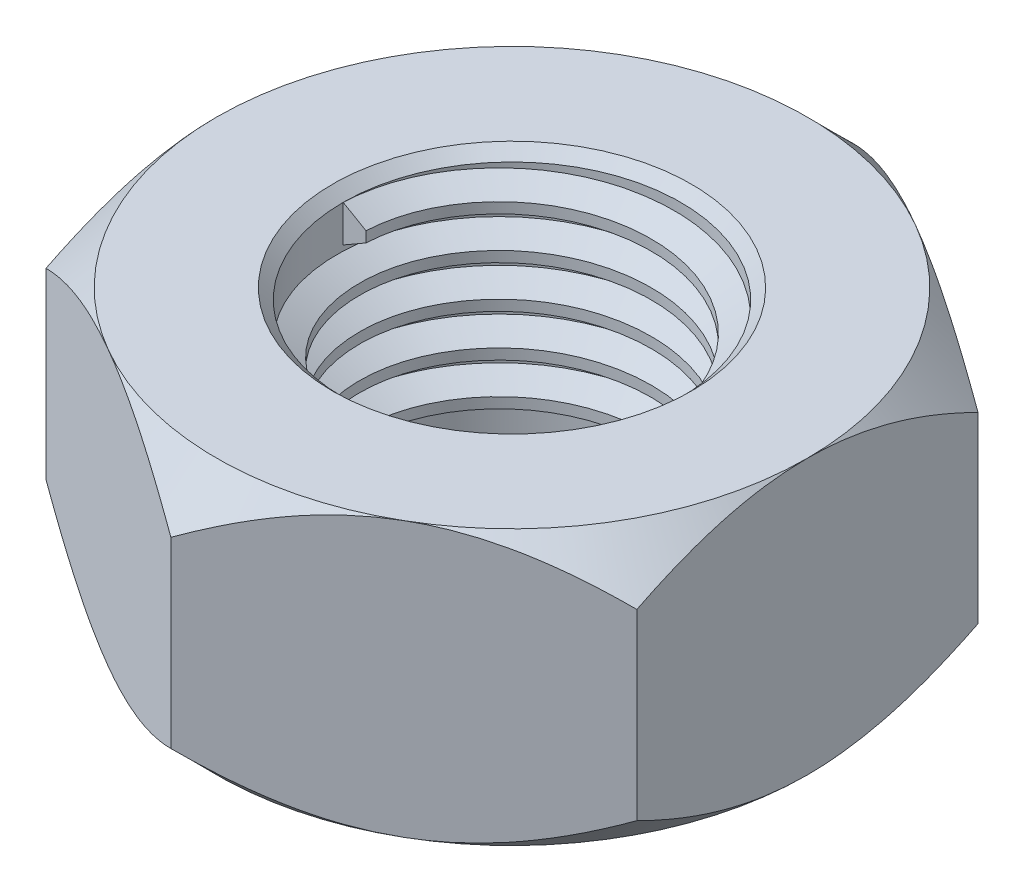
from build123d import *

# Parameters (mm, degrees)
BOSS_EXTRUDE1_DEPTH      = 3.25
BOSS_EXTRUDE1_DEPTH_BACK = 3.25
SKETCH1_R                = 4
SKETCH2_OUTSIDE_W        = 33.47
SKETCH2_OUTSIDE_H        = 35.636
SKETCH2_OUTSIDE_R        = 7
CUT_EXTRUDE1_DEPTH       = 6.5
CUT_EXTRUDE1_DRAFT       = -45
MIRROR2_COPY_1_SKETCH_W  = 33.47
MIRROR2_COPY_1_SKETCH_H  = 35.636
MIRROR2_COPY_1_SKETCH_R  = 7
MIRROR2_COPY_1_DEPTH     = 6.5
MIRROR2_COPY_1_DRAFT     = -45
CHAMFER2_SIZE            = 0.25
THREAD1_PITCH            = 1


with BuildPart() as part:
    # Sketch1 → Boss-Extrude1 (new, two sides: drawn at the far end of the back side and taken through both)
    with BuildSketch(Plane(origin=(0, 0, 0), x_dir=(1, 0, 0), z_dir=(0, 1, 0)).offset(-BOSS_EXTRUDE1_DEPTH_BACK)):
        Polygon((0, 8.082903769), (-7, 4.041451884), (-7, -4.041451884), (0, -8.082903769), (7, -4.041451884), (7, 4.041451884), align=None)
        with Locations(Location((0, 0, 0), (0, 0, 270))):
            Circle(SKETCH1_R, mode=Mode.SUBTRACT)
    extrude(amount=BOSS_EXTRUDE1_DEPTH + BOSS_EXTRUDE1_DEPTH_BACK)


with BuildPart() as cut_extrude1_tool:
    # Sketch2 outside → Cut-Extrude1 (with draft: the straight prism first)
    with BuildSketch(Plane(origin=(0, 3.25, 0), x_dir=(1, 0, 0), z_dir=(0, 1, 0))):
        Rectangle(SKETCH2_OUTSIDE_W, SKETCH2_OUTSIDE_H)
        Circle(SKETCH2_OUTSIDE_R, mode=Mode.SUBTRACT)
    extrude(amount=-CUT_EXTRUDE1_DEPTH)
    # Cut-Extrude1: the draft: its side faces are tilted about the plane it starts from
    cut_extrude1_sides = [cut_extrude1_tool.faces().sort_by_distance(p)[0] for p in [
        (0, 0, 17.818),
        (16.735, 0, 0),
        (0, 0, -17.818),
        (-16.735, 0, 0),
        (-7, 0, 0),
    ]]
    draft(cut_extrude1_sides, Plane(origin=(0, 3.25, 0), x_dir=(1, 0, 0), z_dir=(0, 1, 0)), CUT_EXTRUDE1_DRAFT)


with BuildPart() as part_1:
    add(part.part)

    # Cut-Extrude1: cut by cut_extrude1_tool
    add(cut_extrude1_tool.part, mode=Mode.SUBTRACT)


with BuildPart() as mirror2_copy_1_tool:
    # Mirror2 copy 1 sketch → Mirror2 copy 1 (with draft: the straight prism first)
    with BuildSketch(Plane.XZ.offset(3.25)):
        Rectangle(MIRROR2_COPY_1_SKETCH_W, MIRROR2_COPY_1_SKETCH_H)
        Circle(MIRROR2_COPY_1_SKETCH_R, mode=Mode.SUBTRACT)
    extrude(amount=-MIRROR2_COPY_1_DEPTH)
    # Mirror2 copy 1: the draft: its side faces are tilted about the plane it starts from
    mirror2_copy_1_sides = [mirror2_copy_1_tool.faces().sort_by_distance(p)[0] for p in [
        (0, 0, 17.818),
        (16.735, 0, 0),
        (0, 0, -17.818),
        (-16.735, 0, 0),
        (-7, 0, 0),
    ]]
    draft(mirror2_copy_1_sides, Plane.XZ.offset(3.25), MIRROR2_COPY_1_DRAFT)


with BuildPart() as part_2:
    add(part_1.part)

    # Mirror2 copy 1: cut by mirror2_copy_1_tool
    add(mirror2_copy_1_tool.part, mode=Mode.SUBTRACT)

    # Chamfer2
    chamfer2_edges = [part_2.edges().sort_by_distance(p)[0] for p in [
        (0, -3.25, -4),
        (0, 3.25, -4),
    ]]
    chamfer(chamfer2_edges, length=CHAMFER2_SIZE)

    # Thread1: the profile of Thread Profile1 profile screwed along a right-hand helix of 5 turns, 8 arcs to a turn; built about Z, then put on its axis
    thread1_z = Axis((0, 0, 0), (0, 0, 1))
    thread1_corners = [(4.0003, 0, -0.000173205), (4.0003, 0, 0.875173202), (3.458734125, 0, 0.562499999), (3.458734125, 0, 0.312499999)]
    with BuildLine(mode=Mode.PRIVATE) as thread1_profile:
        Line(thread1_corners[0], thread1_corners[1])
        Line(thread1_corners[1], thread1_corners[2])
        Line(thread1_corners[2], thread1_corners[3])
        Line(thread1_corners[3], thread1_corners[0])
    thread1_cap = Face(thread1_profile.wire())
    thread1_turn_angles = [0, 22.5, 45, 67.5, 90, 112.5, 135, 157.5, 180, 202.5, 225, 247.5, 270, 292.5, 315, 337.5, 360]
    thread1_turn_weights = [1, 0.9238795325112867, 1, 0.9238795325112867, 1, 0.9238795325112867, 1, 0.9238795325112867, 1, 0.9238795325112867, 1, 0.9238795325112867, 1, 0.9238795325112867, 1, 0.9238795325112867, 1]
    thread1_turn_rails = [Edge.make_bspline([Vector(p[0], p[1], 0).rotate(thread1_z, thread1_turn_angles[k]) / thread1_turn_weights[k] + Vector(0, 0, p[2] + THREAD1_PITCH * thread1_turn_angles[k] / 360) for k in range(17)], [0, 0, 0, 1, 1, 2, 2, 3, 3, 4, 4, 5, 5, 6, 6, 7, 7, 8, 8, 8], 2, thread1_turn_weights) for p in thread1_corners]
    thread1_turn_sides = [Face.make_surface_from_curves(thread1_turn_rails[p[0]], thread1_turn_rails[p[1]]) for p in [(0, 1), (1, 2), (2, 3), (3, 0)]]
    thread1 = Plane(origin=(0, 3, 0), x_dir=(-1, 0, 0), z_dir=(0, -1, 0)) * Solid(Shell([*[p.moved(Location((0, 0, THREAD1_PITCH * i))) for i in range(5) for p in thread1_turn_sides], thread1_cap, thread1_cap.rotate(thread1_z, 1800).moved(Location((0, 0, THREAD1_PITCH * 1800 / 360)))]))
    add(thread1)


solid = part_2.part
